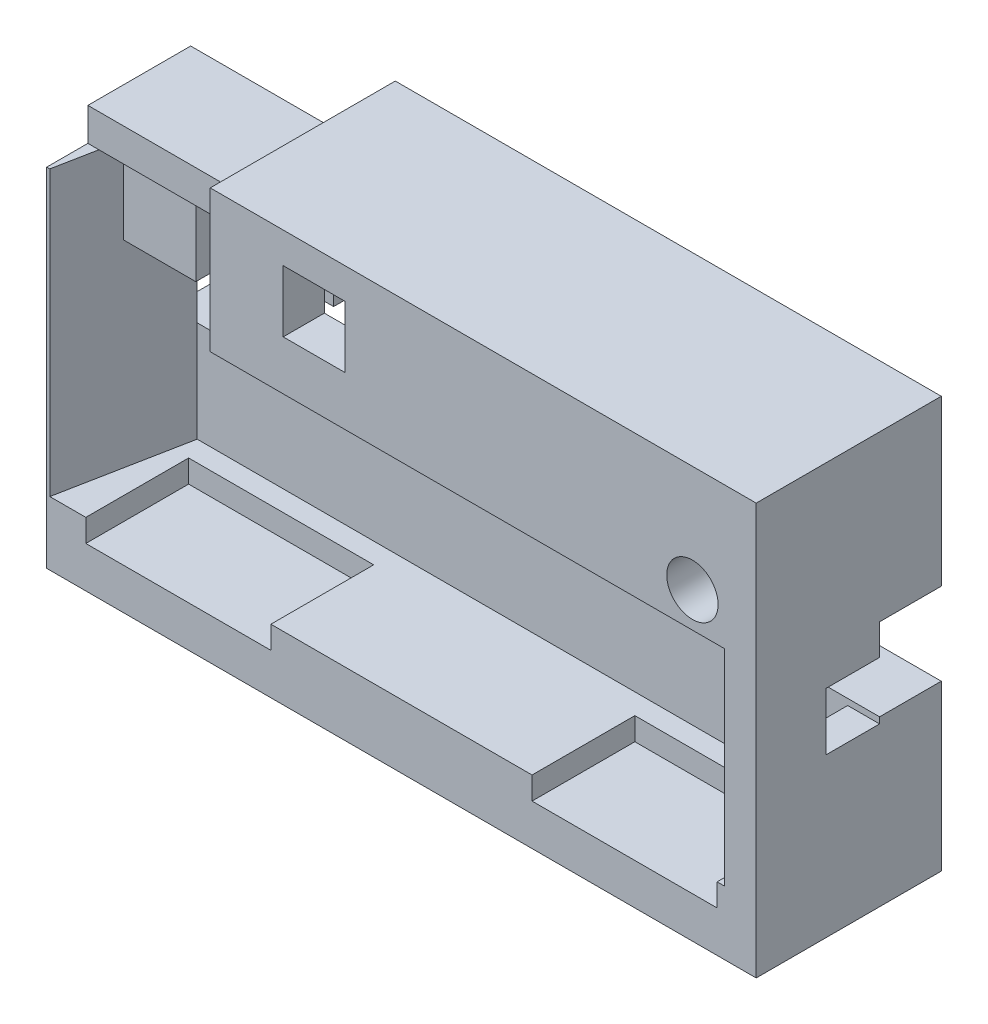
from build123d import *

# Parameters (mm, degrees)
SKETCH1_W           = 34.5
SKETCH1_H           = 20
BOSS_EXTRUDE1_DEPTH = 9
CUT_EXTRUDE1_DEPTH  = 6
SKETCH5_W           = 3
SKETCH5_H           = 4
CUT_EXTRUDE2_DEPTH  = 35
SKETCH7_W           = 2.7
SKETCH7_H           = 4.2
BOSS_EXTRUDE3_DEPTH = 3
SKETCH14_R          = 0.75
CUT_EXTRUDE9_DEPTH  = 2
SKETCH8_R           = 1.25
SKETCH8_W           = 9
SKETCH8_H           = 1.1
CUT_EXTRUDE3_DEPTH  = 5
CHAMFER1_SIZE       = 1.4
CHAMFER1_SIZE_2     = 7.202375622
SKETCH6_W           = 31.5
SKETCH6_H           = 5
CUT_EXTRUDE6_DEPTH  = 2
SKETCH11_W          = 2.6
SKETCH11_H          = 2.8
CUT_EXTRUDE7_DEPTH  = 2
SKETCH12_W          = 3
SKETCH12_H          = 3
CUT_EXTRUDE8_DEPTH  = 7
SKETCH16_W          = 7.95
SKETCH16_H          = 3.1
CUT_EXTRUDE10_DEPTH = 2
SKETCH17_W          = 7.95
SKETCH17_H          = 7
CUT_EXTRUDE11_DEPTH = 1.5
SKETCH18_W          = 1.5
SKETCH18_H          = 5
CUT_EXTRUDE12_DEPTH = 2
SKETCH20_W          = 22.05
SKETCH20_H          = 3.75
CUT_EXTRUDE13_DEPTH = 7
SKETCH21_W          = 7.2
SKETCH21_H          = 2.75
CUT_EXTRUDE14_DEPTH = 5


with BuildPart() as part:
    # Sketch1 → Boss-Extrude1 (new body)
    with BuildSketch(Plane.XY):
        Rectangle(SKETCH1_W, SKETCH1_H)
    extrude(amount=BOSS_EXTRUDE1_DEPTH)

    # Sketch3 → Cut-Extrude1 (cut)
    with BuildSketch(Plane.XY.offset(9)):
        Polygon((15.7, -6.9), (15.7, 3.1), (-9.3, 3.1), (-9.3, 6.9), (-15.7, 6.9), (-15.7, -6.9), align=None)
    extrude(amount=-CUT_EXTRUDE1_DEPTH, mode=Mode.SUBTRACT)

    # Sketch5 → Cut-Extrude2 (cut)
    with BuildSketch(Plane(origin=(17.25, 0, 0), x_dir=(0, 0, -1), z_dir=(1, 0, 0))):
        with Locations((-1.5, 0)):
            Rectangle(SKETCH5_W, SKETCH5_H)
    extrude(amount=-CUT_EXTRUDE2_DEPTH, mode=Mode.SUBTRACT)

    # Sketch7 → Boss-Extrude3 (add)
    with BuildSketch(Plane.XY.offset(3)):
        with Locations((-14.35, 4.8)):
            Rectangle(SKETCH7_W, SKETCH7_H)
    extrude(amount=BOSS_EXTRUDE3_DEPTH)

    # Sketch14 → Cut-Extrude9 (cut)
    with BuildSketch(Plane.XY.offset(3)):
        with Locations((-11, 5.3)):
            Circle(SKETCH14_R)
    extrude(amount=-CUT_EXTRUDE9_DEPTH, mode=Mode.SUBTRACT)

    # Sketch8 → Cut-Extrude3 (cut)
    with BuildSketch(Plane.XY.offset(9)):
        with Locations((14.149147106, 4.8)):
            Circle(SKETCH8_R)
        with Locations((-10.85, -7.45)):
            Rectangle(SKETCH8_W, SKETCH8_H)
        with Locations((10.85, -7.45)):
            Rectangle(SKETCH8_W, SKETCH8_H)
    extrude(amount=-CUT_EXTRUDE3_DEPTH, mode=Mode.SUBTRACT)

    # Chamfer1
    # the kernel refuses this chamfer: 7.202375622, 1.4 mm, written as the material it takes off along each edge
    with BuildSketch(Plane(origin=(-15.7, 6.9, 9), x_dir=(-0.9816291836389949, 0, 0.190798704996235), z_dir=(0, -1, 0))) as chamfer1_piece_1_section:
        Polygon((CHAMFER1_SIZE * 0.981629183639, CHAMFER1_SIZE * 0.190798704996), (-CHAMFER1_SIZE_2 * 0.190798705006, CHAMFER1_SIZE_2 * 0.981629183688), (0, 0), align=None)
    chamfer1_piece_1 = extrude(amount=13.8, mode=Mode.PRIVATE)
    chamfer1_piece_1 = split(chamfer1_piece_1, bisect_by=Plane(origin=(-16.266997619, 4.8, 6), z_dir=(0, 0, 1)), keep=Keep.TOP, mode=Mode.PRIVATE)
    add(chamfer1_piece_1, mode=Mode.SUBTRACT)
    with BuildSketch(Plane(origin=(-15.7, 25.613448453, 9), x_dir=(-0.9816291836389951, 0, 0.19079870499623477), z_dir=(0, -1, 0))) as chamfer1_piece_2_section:
        Polygon((CHAMFER1_SIZE * 0.981629183639, CHAMFER1_SIZE * 0.190798704996), (-CHAMFER1_SIZE_2 * 0.190798705006, CHAMFER1_SIZE_2 * 0.981629183688), (0, 0), align=None)
    chamfer1_piece_2 = extrude(amount=32.513448453, mode=Mode.PRIVATE)
    chamfer1_piece_2 = split(chamfer1_piece_2, bisect_by=Plane(origin=(-15.989617837, 2.35, 3), z_dir=(0, 0, 1)), keep=Keep.TOP, mode=Mode.PRIVATE)
    chamfer1_piece_2 = split(chamfer1_piece_2, bisect_by=Plane(origin=(-15.989617837, 2.7, 4.777533587), z_dir=(0, -1, 0)), keep=Keep.TOP, mode=Mode.PRIVATE)
    add(chamfer1_piece_2, mode=Mode.SUBTRACT)

    # Sketch6 → Cut-Extrude6 (cut)
    with BuildSketch(Plane(origin=(0, 0, 0), x_dir=(-1, 0, 0), z_dir=(0, 0, -1))):
        with Locations((0, 6)):
            Rectangle(SKETCH6_W, SKETCH6_H)
        with Locations((0, -6)):
            Rectangle(SKETCH6_W, SKETCH6_H)
    extrude(amount=-CUT_EXTRUDE6_DEPTH, mode=Mode.SUBTRACT)

    # Sketch11 → Cut-Extrude7 (cut)
    with BuildSketch(Plane(origin=(17.25, 0, 0), x_dir=(0, 0, -1), z_dir=(1, 0, 0))):
        with Locations((-4.3, -0.9)):
            Rectangle(SKETCH11_W, SKETCH11_H)
    extrude(amount=-CUT_EXTRUDE7_DEPTH, mode=Mode.SUBTRACT)

    # Sketch12 → Cut-Extrude8 (cut)
    with BuildSketch(Plane(origin=(0, 0, 2), x_dir=(-1, 0, 0), z_dir=(0, 0, -1))):
        with Locations((4.25, 7)):
            Rectangle(SKETCH12_W, SKETCH12_H)
    extrude(amount=-CUT_EXTRUDE8_DEPTH, mode=Mode.SUBTRACT)

    # Sketch16 → Cut-Extrude10 (cut)
    with BuildSketch(Plane.XY.offset(9)):
        with Locations((-13.275, 8.45)):
            Rectangle(SKETCH16_W, SKETCH16_H)
    extrude(amount=-CUT_EXTRUDE10_DEPTH, mode=Mode.SUBTRACT)

    # Sketch17 → Cut-Extrude11 (cut)
    with BuildSketch(Plane(origin=(0, 10, 0), x_dir=(1, 0, 0), z_dir=(0, 1, 0))):
        with Locations((-13.275, -3.5)):
            Rectangle(SKETCH17_W, SKETCH17_H)
    extrude(amount=-CUT_EXTRUDE11_DEPTH, mode=Mode.SUBTRACT)

    # Sketch18 → Cut-Extrude12 (cut)
    with BuildSketch(Plane.XY):
        with Locations((-16.5, 6)):
            Rectangle(SKETCH18_W, SKETCH18_H)
    extrude(amount=CUT_EXTRUDE12_DEPTH, mode=Mode.SUBTRACT)

    # Sketch20 → Cut-Extrude13 (cut)
    with BuildSketch(Plane(origin=(0, 0, 0), x_dir=(-1, 0, 0), z_dir=(0, 0, -1))):
        with Locations((-1.725, 3.875)):
            Rectangle(SKETCH20_W, SKETCH20_H)
    extrude(amount=-CUT_EXTRUDE13_DEPTH, mode=Mode.SUBTRACT)

    # Sketch21 → Cut-Extrude14 (cut)
    with BuildSketch(Plane(origin=(0, 0, 2), x_dir=(-1, 0, 0), z_dir=(0, 0, -1))):
        with Locations((4.25, 7.125)):
            Rectangle(SKETCH21_W, SKETCH21_H)
    extrude(amount=-CUT_EXTRUDE14_DEPTH, mode=Mode.SUBTRACT)


solid = part.part
